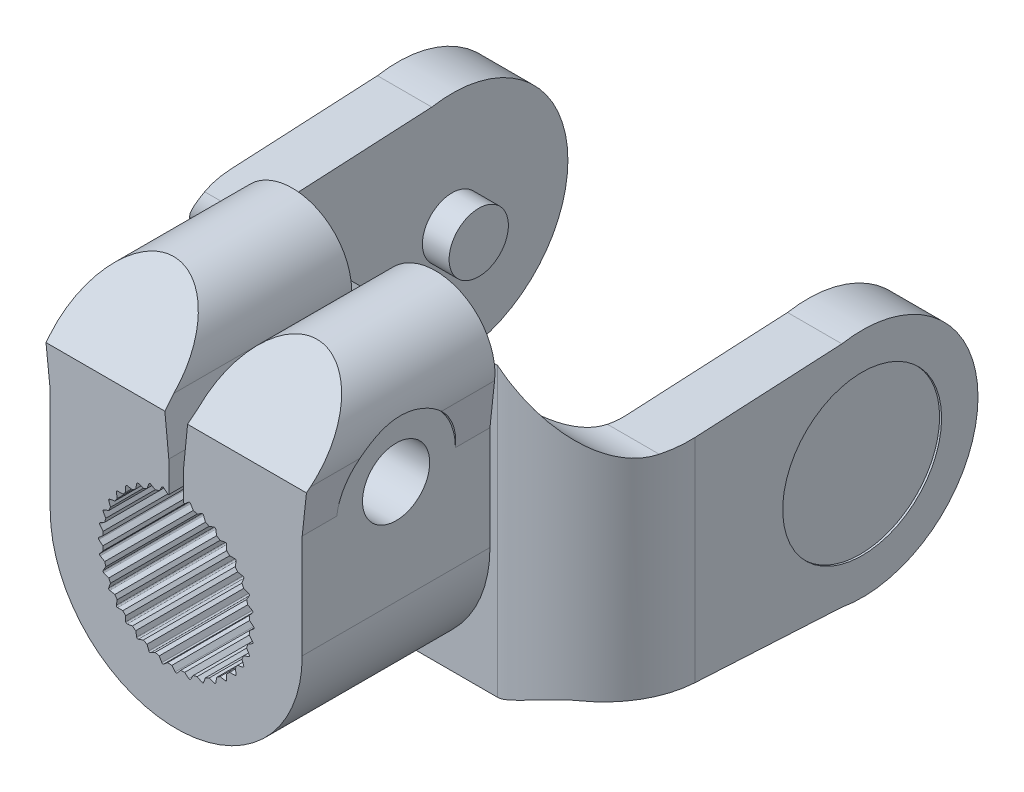
from build123d import *

# Parameters (mm, degrees)
Y_KSEKLIK_EKSTR_ZYON1_DEPTH      = 19
KES_EKSTR_ZYON2_START            = -26
KES_EKSTR_ZYON2_DEPTH            = 26.5
Y_KSEKLIK_EKSTR_ZYON4_DEPTH      = 23.5
Y_KSEKLIK_EKSTR_ZYON4_DEPTH_BACK = 23.5
IZIM7_R                          = 8.04
KES_EKSTR_ZYON3_DEPTH            = 67.156003767
KES_EKSTR_ZYON3_DEPTH_BACK       = 67.156003767
IZIM9_W                          = 36
IZIM9_H                          = 43.420925589
RADYUS4_R                        = 10
RADYUS5_R                        = 5
KES_EKSTR_ZYON4_DEPTH            = 72.402297102
KES_EKSTR_ZYON4_DEPTH_BACK       = 72.402297102
IZIM10_R                         = 3.4
Y_KSEKLIK_EKSTR_ZYON5_START      = -2.3
IZIM13_R                         = 8.04
IZIM13_R_2                       = 3
Y_KSEKLIK_EKSTR_ZYON5_DEPTH      = 2.3
IZIM14_R                         = 8.04
IZIM14_R_2                       = 3
Y_KSEKLIK_EKSTR_ZYON6_DEPTH      = 2.3
IZIM15_R                         = 6
KES_EKSTR_ZYON5_DEPTH            = 10
KES_EKSTR_ZYON6_START            = 10
IZIM16_R                         = 6
KES_EKSTR_ZYON6_DEPTH            = 10
SKETCH1_R                        = 8.04
SKETCH1_R_2                      = 3
BOSS_EXTRUDE1_DEPTH              = 3
SKETCH2_R                        = 3
BOSS_EXTRUDE2_DEPTH              = 8


# Read off the part's stored shape, not the designer's step: Kes-Ekstrüzyon2
with BuildPart() as part:
    # Çizim1 → Yükseklik-Ekstrüzyon1 (new body)
    with BuildSketch(Plane.XY):
        with BuildLine():
            Line((1.25, 15.499954464), (0.75, 10.499954464))
            Line((0.75, 10.499954464), (0.75, 8.950475835))
            Line((0.75, 8.950475835), (0.75, 7.386733823))
            Line((0.75, 7.386733823), (0.855884222, 7.386733823))
            Line((0.855884222, 7.386733823), (1.261203123, 7.726836763))
            ThreePointArc((1.261203123, 7.726836763), (1.367470581, 7.755311042), (1.457590549, 7.692208361))
            Line((1.457590549, 7.692208361), (1.722143673, 7.23398891))
            ThreePointArc((1.722143673, 7.23398891), (1.92461807, 7.182772421), (2.125574285, 7.125890003))
            Line((2.125574285, 7.125890003), (2.583793737, 7.390443126))
            ThreePointArc((2.583793737, 7.390443126), (2.69339126, 7.400031667), (2.771184438, 7.322238489))
            Line((2.771184438, 7.322238489), (2.952149432, 6.825041253))
            ThreePointArc((2.952149432, 6.825041253), (3.142654138, 6.739443548), (3.330679849, 6.648529621))
            Line((3.330679849, 6.648529621), (3.827877085, 6.829494615))
            ThreePointArc((3.827877085, 6.829494615), (3.937474608, 6.819906075), (4.000577289, 6.729786106))
            Line((4.000577289, 6.729786106), (4.092455625, 6.208718171))
            ThreePointArc((4.092455625, 6.208718171), (4.265202251, 6.091340093), (4.434584391, 5.96915703))
            Line((4.434584391, 5.96915703), (4.955652325, 6.061035366))
            ThreePointArc((4.955652325, 6.061035366), (5.061919783, 6.032561087), (5.108414624, 5.932852577))
            Line((5.108414624, 5.932852577), (5.108414624, 5.40374633))
            ThreePointArc((5.108414624, 5.40374633), (5.258154352, 5.258154352), (5.40374633, 5.108414624))
            Line((5.40374633, 5.108414624), (5.932852577, 5.108414624))
            ThreePointArc((5.932852577, 5.108414624), (6.032561087, 5.061919783), (6.061035366, 4.955652325))
            Line((6.061035366, 4.955652325), (5.96915703, 4.434584391))
            ThreePointArc((5.96915703, 4.434584391), (6.091340093, 4.265202251), (6.208718171, 4.092455625))
            Line((6.208718171, 4.092455625), (6.729786106, 4.000577289))
            ThreePointArc((6.729786106, 4.000577289), (6.819906075, 3.937474608), (6.829494615, 3.827877085))
            Line((6.829494615, 3.827877085), (6.648529621, 3.330679849))
            ThreePointArc((6.648529621, 3.330679849), (6.739443548, 3.142654138), (6.825041253, 2.952149432))
            Line((6.825041253, 2.952149432), (7.322238489, 2.771184438))
            ThreePointArc((7.322238489, 2.771184438), (7.400031667, 2.69339126), (7.390443126, 2.583793737))
            Line((7.390443126, 2.583793737), (7.125890003, 2.125574285))
            ThreePointArc((7.125890003, 2.125574285), (7.182772421, 1.92461807), (7.23398891, 1.722143673))
            Line((7.23398891, 1.722143673), (7.692208361, 1.457590549))
            ThreePointArc((7.692208361, 1.457590549), (7.755311042, 1.367470581), (7.726836763, 1.261203123))
            Line((7.726836763, 1.261203123), (7.386733823, 0.855884222))
            ThreePointArc((7.386733823, 0.855884222), (7.407856389, 0.648103455), (7.423135474, 0.439811449))
            Line((7.423135474, 0.439811449), (7.828454374, 0.099708509))
            ThreePointArc((7.828454374, 0.099708509), (7.874949216, 0), (7.828454374, -0.099708509))
            Line((7.828454374, -0.099708509), (7.423135474, -0.439811449))
            ThreePointArc((7.423135474, -0.439811449), (7.407856389, -0.648103455), (7.386733823, -0.855884222))
            Line((7.386733823, -0.855884222), (7.726836763, -1.261203123))
            ThreePointArc((7.726836763, -1.261203123), (7.755311042, -1.367470581), (7.692208361, -1.457590549))
            Line((7.692208361, -1.457590549), (7.23398891, -1.722143673))
            ThreePointArc((7.23398891, -1.722143673), (7.182772421, -1.92461807), (7.125890003, -2.125574285))
            Line((7.125890003, -2.125574285), (7.390443126, -2.583793737))
            ThreePointArc((7.390443126, -2.583793737), (7.400031667, -2.69339126), (7.322238489, -2.771184438))
            Line((7.322238489, -2.771184438), (6.825041253, -2.952149432))
            ThreePointArc((6.825041253, -2.952149432), (6.739443548, -3.142654138), (6.648529621, -3.330679849))
            Line((6.648529621, -3.330679849), (6.829494615, -3.827877085))
            ThreePointArc((6.829494615, -3.827877085), (6.819906075, -3.937474608), (6.729786106, -4.000577289))
            Line((6.729786106, -4.000577289), (6.208718171, -4.092455625))
            ThreePointArc((6.208718171, -4.092455625), (6.091340093, -4.265202251), (5.96915703, -4.434584391))
            Line((5.96915703, -4.434584391), (6.061035366, -4.955652325))
            ThreePointArc((6.061035366, -4.955652325), (6.032561087, -5.061919783), (5.932852577, -5.108414624))
            Line((5.932852577, -5.108414624), (5.40374633, -5.108414624))
            ThreePointArc((5.40374633, -5.108414624), (5.258154352, -5.258154352), (5.108414624, -5.40374633))
            Line((5.108414624, -5.40374633), (5.108414624, -5.932852577))
            ThreePointArc((5.108414624, -5.932852577), (5.061919783, -6.032561087), (4.955652325, -6.061035366))
            Line((4.955652325, -6.061035366), (4.434584391, -5.96915703))
            ThreePointArc((4.434584391, -5.96915703), (4.265202251, -6.091340093), (4.092455625, -6.208718171))
            Line((4.092455625, -6.208718171), (4.000577289, -6.729786106))
            ThreePointArc((4.000577289, -6.729786106), (3.937474608, -6.819906075), (3.827877085, -6.829494615))
            Line((3.827877085, -6.829494615), (3.330679849, -6.648529621))
            ThreePointArc((3.330679849, -6.648529621), (3.142654138, -6.739443548), (2.952149432, -6.825041253))
            Line((2.952149432, -6.825041253), (2.771184438, -7.322238489))
            ThreePointArc((2.771184438, -7.322238489), (2.69339126, -7.400031667), (2.583793737, -7.390443126))
            Line((2.583793737, -7.390443126), (2.125574285, -7.125890003))
            ThreePointArc((2.125574285, -7.125890003), (1.92461807, -7.182772421), (1.722143673, -7.23398891))
            Line((1.722143673, -7.23398891), (1.457590549, -7.692208361))
            ThreePointArc((1.457590549, -7.692208361), (1.367470581, -7.755311042), (1.261203123, -7.726836763))
            Line((1.261203123, -7.726836763), (0.855884222, -7.386733823))
            ThreePointArc((0.855884222, -7.386733823), (0.648103455, -7.407856389), (0.439811449, -7.423135474))
            Line((0.439811449, -7.423135474), (0.099708509, -7.828454374))
            ThreePointArc((0.099708509, -7.828454374), (0, -7.874949216), (-0.099708509, -7.828454374))
            Line((-0.099708509, -7.828454374), (-0.439811449, -7.423135474))
            ThreePointArc((-0.439811449, -7.423135474), (-0.648103455, -7.407856389), (-0.855884222, -7.386733823))
            Line((-0.855884222, -7.386733823), (-1.261203123, -7.726836763))
            ThreePointArc((-1.261203123, -7.726836763), (-1.367470581, -7.755311042), (-1.457590549, -7.692208361))
            Line((-1.457590549, -7.692208361), (-1.722143673, -7.23398891))
            ThreePointArc((-1.722143673, -7.23398891), (-1.92461807, -7.182772421), (-2.125574285, -7.125890003))
            Line((-2.125574285, -7.125890003), (-2.583793737, -7.390443126))
            ThreePointArc((-2.583793737, -7.390443126), (-2.69339126, -7.400031667), (-2.771184438, -7.322238489))
            Line((-2.771184438, -7.322238489), (-2.952149432, -6.825041253))
            ThreePointArc((-2.952149432, -6.825041253), (-3.142654138, -6.739443548), (-3.330679849, -6.648529621))
            Line((-3.330679849, -6.648529621), (-3.827877085, -6.829494615))
            ThreePointArc((-3.827877085, -6.829494615), (-3.937474608, -6.819906075), (-4.000577289, -6.729786106))
            Line((-4.000577289, -6.729786106), (-4.092455625, -6.208718171))
            ThreePointArc((-4.092455625, -6.208718171), (-4.265202251, -6.091340093), (-4.434584391, -5.96915703))
            Line((-4.434584391, -5.96915703), (-4.955652325, -6.061035366))
            ThreePointArc((-4.955652325, -6.061035366), (-5.061919783, -6.032561087), (-5.108414624, -5.932852577))
            Line((-5.108414624, -5.932852577), (-5.108414624, -5.40374633))
            ThreePointArc((-5.108414624, -5.40374633), (-5.258154352, -5.258154352), (-5.40374633, -5.108414624))
            Line((-5.40374633, -5.108414624), (-5.932852577, -5.108414624))
            ThreePointArc((-5.932852577, -5.108414624), (-6.032561087, -5.061919783), (-6.061035366, -4.955652325))
            Line((-6.061035366, -4.955652325), (-5.96915703, -4.434584391))
            ThreePointArc((-5.96915703, -4.434584391), (-6.091340093, -4.265202251), (-6.208718171, -4.092455625))
            Line((-6.208718171, -4.092455625), (-6.729786106, -4.000577289))
            ThreePointArc((-6.729786106, -4.000577289), (-6.819906075, -3.937474608), (-6.829494615, -3.827877085))
            Line((-6.829494615, -3.827877085), (-6.648529621, -3.330679849))
            ThreePointArc((-6.648529621, -3.330679849), (-6.739443548, -3.142654138), (-6.825041253, -2.952149432))
            Line((-6.825041253, -2.952149432), (-7.322238489, -2.771184438))
            ThreePointArc((-7.322238489, -2.771184438), (-7.400031667, -2.69339126), (-7.390443126, -2.583793737))
            Line((-7.390443126, -2.583793737), (-7.125890003, -2.125574285))
            ThreePointArc((-7.125890003, -2.125574285), (-7.182772421, -1.92461807), (-7.23398891, -1.722143673))
            Line((-7.23398891, -1.722143673), (-7.692208361, -1.457590549))
            ThreePointArc((-7.692208361, -1.457590549), (-7.755311042, -1.367470581), (-7.726836763, -1.261203123))
            Line((-7.726836763, -1.261203123), (-7.386733823, -0.855884222))
            ThreePointArc((-7.386733823, -0.855884222), (-7.407856389, -0.648103455), (-7.423135474, -0.439811449))
            Line((-7.423135474, -0.439811449), (-7.828454374, -0.099708509))
            ThreePointArc((-7.828454374, -0.099708509), (-7.874949216, 0), (-7.828454374, 0.099708509))
            Line((-7.828454374, 0.099708509), (-7.423135474, 0.439811449))
            ThreePointArc((-7.423135474, 0.439811449), (-7.407856389, 0.648103455), (-7.386733823, 0.855884222))
            Line((-7.386733823, 0.855884222), (-7.726836763, 1.261203123))
            ThreePointArc((-7.726836763, 1.261203123), (-7.755311042, 1.367470581), (-7.692208361, 1.457590549))
            Line((-7.692208361, 1.457590549), (-7.23398891, 1.722143673))
            ThreePointArc((-7.23398891, 1.722143673), (-7.182772421, 1.92461807), (-7.125890003, 2.125574285))
            Line((-7.125890003, 2.125574285), (-7.390443126, 2.583793737))
            ThreePointArc((-7.390443126, 2.583793737), (-7.400031667, 2.69339126), (-7.322238489, 2.771184438))
            Line((-7.322238489, 2.771184438), (-6.825041253, 2.952149432))
            ThreePointArc((-6.825041253, 2.952149432), (-6.739443548, 3.142654138), (-6.648529621, 3.330679849))
            Line((-6.648529621, 3.330679849), (-6.829494615, 3.827877085))
            ThreePointArc((-6.829494615, 3.827877085), (-6.819906075, 3.937474608), (-6.729786106, 4.000577289))
            Line((-6.729786106, 4.000577289), (-6.208718171, 4.092455625))
            ThreePointArc((-6.208718171, 4.092455625), (-6.091340093, 4.265202251), (-5.96915703, 4.434584391))
            Line((-5.96915703, 4.434584391), (-6.061035366, 4.955652325))
            ThreePointArc((-6.061035366, 4.955652325), (-6.032561087, 5.061919783), (-5.932852577, 5.108414624))
            Line((-5.932852577, 5.108414624), (-5.40374633, 5.108414624))
            ThreePointArc((-5.40374633, 5.108414624), (-5.258154352, 5.258154352), (-5.108414624, 5.40374633))
            Line((-5.108414624, 5.40374633), (-5.108414624, 5.932852577))
            ThreePointArc((-5.108414624, 5.932852577), (-5.061919783, 6.032561087), (-4.955652325, 6.061035366))
            Line((-4.955652325, 6.061035366), (-4.434584391, 5.96915703))
            ThreePointArc((-4.434584391, 5.96915703), (-4.265202251, 6.091340093), (-4.092455625, 6.208718171))
            Line((-4.092455625, 6.208718171), (-4.000577289, 6.729786106))
            ThreePointArc((-4.000577289, 6.729786106), (-3.937474608, 6.819906075), (-3.827877085, 6.829494615))
            Line((-3.827877085, 6.829494615), (-3.330679849, 6.648529621))
            ThreePointArc((-3.330679849, 6.648529621), (-3.142654138, 6.739443548), (-2.952149432, 6.825041253))
            Line((-2.952149432, 6.825041253), (-2.771184438, 7.322238489))
            ThreePointArc((-2.771184438, 7.322238489), (-2.69339126, 7.400031667), (-2.583793737, 7.390443126))
            Line((-2.583793737, 7.390443126), (-2.125574285, 7.125890003))
            ThreePointArc((-2.125574285, 7.125890003), (-1.92461807, 7.182772421), (-1.722143673, 7.23398891))
            Line((-1.722143673, 7.23398891), (-1.457590549, 7.692208361))
            ThreePointArc((-1.457590549, 7.692208361), (-1.367470581, 7.755311042), (-1.261203123, 7.726836763))
            Line((-1.261203123, 7.726836763), (-0.855884222, 7.386733823))
            Line((-0.855884222, 7.386733823), (-0.75, 7.386733823))
            Line((-0.75, 7.386733823), (-0.75, 8.952015392))
            Line((-0.75, 8.952015392), (-0.75, 10.499954464))
            Line((-0.75, 10.499954464), (-1.25, 15.499954464))
            ThreePointArc((-1.25, 15.499954464), (-7.574483533, 21.491173909), (-13.214903479, 14.851937112))
            Line((-13.214903479, 14.851937112), (-12.75, 10.499954464))
            Line((-12.75, 10.499954464), (-12.75, 0))
            ThreePointArc((-12.75, 0), (0, -12.75), (12.75, 0))
            Line((12.75, 0), (12.75, 10.499954464))
            Line((12.75, 10.499954464), (13.214903479, 14.851937112))
            ThreePointArc((13.214903479, 14.851937112), (7.574483533, 21.491173909), (1.25, 15.499954464))
        make_face()
    extrude(amount=-Y_KSEKLIK_EKSTR_ZYON1_DEPTH)

    # Kes-Ekstrüzyon2 outline → Kes-Ekstrüzyon2 (cut)
    with BuildSketch(Plane(origin=(12.75, 0, 0), x_dir=(0, 0, -1), z_dir=(1, 0, 0)).offset(KES_EKSTR_ZYON2_START)):
        Polygon((7, 21.499954464), (0, 21.499954464), (0, 14.499954464), align=None)
    extrude(amount=KES_EKSTR_ZYON2_DEPTH, mode=Mode.SUBTRACT)

    # Çizim7 → Yükseklik-Ekstrüzyon4 (add, two sides: drawn at the far end of the back side and taken through both)
    with BuildSketch(Plane(origin=(0, 0, 0), x_dir=(0, 0, -1), z_dir=(1, 0, 0)).offset(-Y_KSEKLIK_EKSTR_ZYON4_DEPTH_BACK)):
        with BuildLine():
            Line((21.100622684, -11.038164951), (43.840841444, -12.288792244))
            ThreePointArc((43.840841444, -12.288792244), (57.636592377, -0.76329808), (43.864355831, 10.79028405))
            Line((43.864355831, 10.79028405), (25.879903731, 9.860300021))
            ThreePointArc((25.879903731, 9.860300021), (21.040144299, 11.620585375), (19, 16.349188459))
            Line((19, 16.349188459), (19, -12.75))
            ThreePointArc((19, -12.75), (19.716219036, -11.484111971), (21.100622684, -11.038164951))
        make_face()
        with Locations((45.914321235, -0.749954464)):
            Circle(IZIM7_R, mode=Mode.SUBTRACT)
    extrude(amount=Y_KSEKLIK_EKSTR_ZYON4_DEPTH + Y_KSEKLIK_EKSTR_ZYON4_DEPTH_BACK)

    # Çizim9 → Kes-Ekstrüzyon3 (cut, two sides: drawn at the far end of the back side and taken through both)
    with BuildSketch(Plane(origin=(0, 8.499311767, 0.439503197), x_dir=(1, 0, 0), z_dir=(0, 0.9986656902512514, 0.051641447646165184)).offset(-KES_EKSTR_ZYON3_DEPTH_BACK)):
        with Locations((0, 44.620609782)):
            Rectangle(IZIM9_W, IZIM9_H)
    extrude(amount=KES_EKSTR_ZYON3_DEPTH + KES_EKSTR_ZYON3_DEPTH_BACK, mode=Mode.SUBTRACT)

    # Radyus4
    radyus4_edges = [part.edges().sort_by_distance(p)[0] for p in [
        (23.5, 1.799594229, -19),
        (-23.5, 1.799594229, -19),
    ]]
    fillet(radyus4_edges, radius=RADYUS4_R)

    # Radyus5
    radyus5_edges = [part.edges().sort_by_distance(p)[0] for p in [
        (-18, -0.264960758, -22.954458301),
        (18, -0.264960758, -22.954458301),
    ]]
    fillet(radyus5_edges, radius=RADYUS5_R)

    # Çizim10 → Kes-Ekstrüzyon4 (cut, two sides: drawn at the far end of the back side and taken through both)
    with BuildSketch(Plane(origin=(12.75, 0, 0), x_dir=(0, 0, -1), z_dir=(1, 0, 0)).offset(-KES_EKSTR_ZYON4_DEPTH_BACK)):
        with Locations((9.5, 10.499954464)):
            Circle(IZIM10_R)
    extrude(amount=KES_EKSTR_ZYON4_DEPTH + KES_EKSTR_ZYON4_DEPTH_BACK, mode=Mode.SUBTRACT)

    # Çizim13 → Yükseklik-Ekstrüzyon5 (add)
    with BuildSketch(Plane(origin=(-18, 0, 0), x_dir=(0, 0, -1), z_dir=(1, 0, 0)).offset(Y_KSEKLIK_EKSTR_ZYON5_START)):
        with Locations((45.914321235, -0.749954464)):
            Circle(IZIM13_R)
        with Locations((45.914321235, -0.749954464)):
            Circle(IZIM13_R_2, mode=Mode.SUBTRACT)
    extrude(amount=Y_KSEKLIK_EKSTR_ZYON5_DEPTH)

    # Çizim14 → Yükseklik-Ekstrüzyon6 (add)
    with BuildSketch(Plane.ZY.offset(-18)):
        with Locations(Location((-45.914321235, -0.749954464, 0), (0, 0, 180))):
            Circle(IZIM14_R)
        with Locations(Location((-45.914321235, -0.749954464, 0), (0, 0, 180))):
            Circle(IZIM14_R_2, mode=Mode.SUBTRACT)
    extrude(amount=-Y_KSEKLIK_EKSTR_ZYON6_DEPTH)

    # Çizim15 → Kes-Ekstrüzyon5 (cut)
    with BuildSketch(Plane(origin=(12.75, 0, 0), x_dir=(0, 0, -1), z_dir=(1, 0, 0))):
        with Locations((9.5, 10.499954464)):
            Circle(IZIM15_R)
    extrude(amount=KES_EKSTR_ZYON5_DEPTH, mode=Mode.SUBTRACT)

    # Çizim16 → Kes-Ekstrüzyon6 (cut)
    with BuildSketch(Plane.ZY.offset(12.75).offset(KES_EKSTR_ZYON6_START)):
        with Locations((-9.5, 10.499954464)):
            Circle(IZIM16_R)
    extrude(amount=-KES_EKSTR_ZYON6_DEPTH, mode=Mode.SUBTRACT)


with BuildPart() as body_2:
    # Sketch1 → Boss-Extrude1 (new body)
    with BuildSketch(Plane.ZY.offset(20.3)):
        with Locations((-45.914321235, -0.749954464)):
            Circle(SKETCH1_R)
        with Locations((-45.914321235, -0.749954464)):
            Circle(SKETCH1_R_2, mode=Mode.SUBTRACT)
    extrude(amount=BOSS_EXTRUDE1_DEPTH)

    # Sketch2 → Boss-Extrude2 (add)
    with BuildSketch(Plane.ZY.offset(23.3)):
        with Locations((-45.914321235, -0.749954464)):
            Circle(SKETCH2_R)
    extrude(amount=-BOSS_EXTRUDE2_DEPTH)


with BuildPart() as body_3:
    # Mirror1: mirrored copy
    add(body_2.part.mirror(Plane.ZY))


solid = Compound([part.part, body_2.part, body_3.part])
